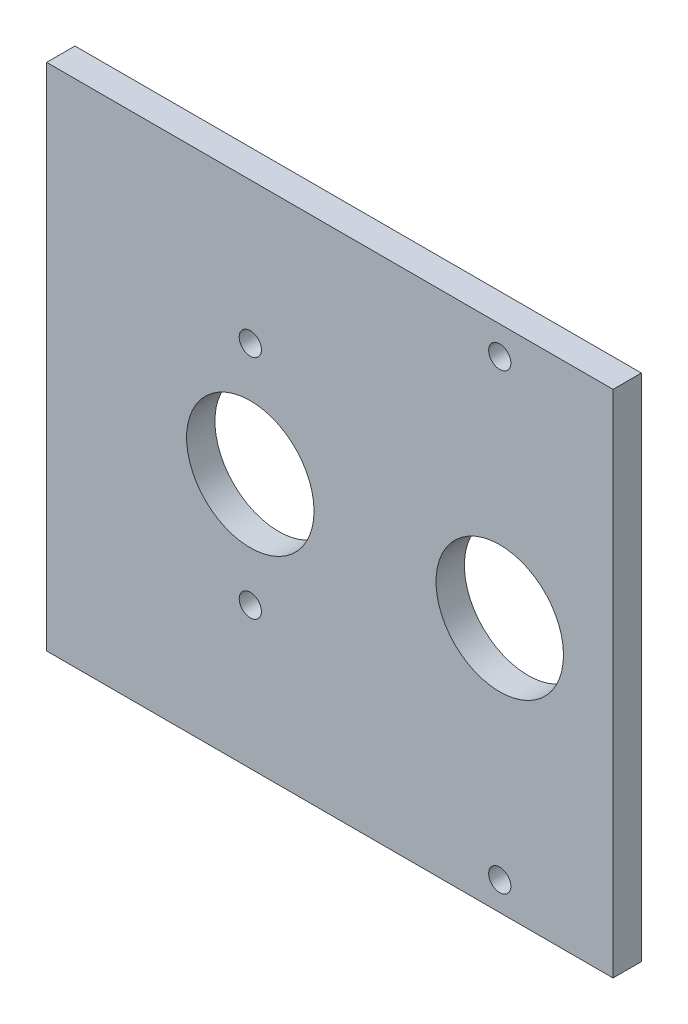
from build123d import *

# Parameters (mm, degrees)
SKETCH1_W           = 127
SKETCH1_H           = 114.3
SKETCH1_R           = 2.4892
SKETCH1_R_2         = 14.2875
BOSS_EXTRUDE1_DEPTH = 3.175


with BuildPart() as part:
    # Sketch1 → Boss-Extrude1 (new, symmetric)
    with BuildSketch(Plane.XY):
        with Locations((63.5, 57.15)):
            Rectangle(SKETCH1_W, SKETCH1_H)
        with Locations((45.6692, 82.55)):
            Circle(SKETCH1_R, mode=Mode.SUBTRACT)
        with Locations((45.6692, 57.15)):
            Circle(SKETCH1_R_2, mode=Mode.SUBTRACT)
        with Locations((45.6692, 31.75)):
            Circle(SKETCH1_R, mode=Mode.SUBTRACT)
        with Locations((101.6, 107.95)):
            Circle(SKETCH1_R, mode=Mode.SUBTRACT)
        with Locations((101.6, 57.15)):
            Circle(SKETCH1_R_2, mode=Mode.SUBTRACT)
        with Locations((101.6, 6.35)):
            Circle(SKETCH1_R, mode=Mode.SUBTRACT)
    extrude(amount=BOSS_EXTRUDE1_DEPTH, both=True)


solid = part.part
